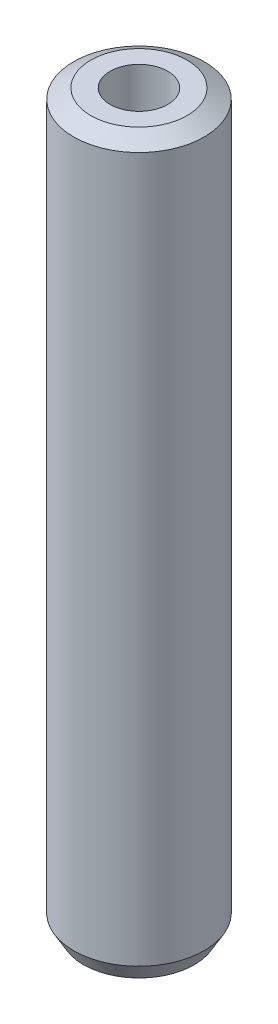
from build123d import *
from OCP.BRepFilletAPI import BRepFilletAPI_MakeChamfer

# Parameters (mm, degrees)
SKETCH1_R           = 20
BOSS_EXTRUDE1_DEPTH = 224.206713029
SKETCH2_R           = 8.832088122
CUT_EXTRUDE1_DEPTH  = 226.983738723
CHAMFER1_SIZE       = 3.035175179
CHAMFER1_SIZE2      = 5.25707762


with BuildPart() as part:
    # Sketch1 → Boss-Extrude1 (new body)
    with BuildSketch(Plane(origin=(0, 0, 0), x_dir=(1, 0, 0), z_dir=(0, 1, 0))):
        Circle(SKETCH1_R)
    extrude(amount=BOSS_EXTRUDE1_DEPTH)

    # Sketch2 → Cut-Extrude1 (cut, through all)
    with BuildSketch(Plane(origin=(0, 0, 0), x_dir=(1, 0, 0), z_dir=(0, 1, 0))):
        Circle(SKETCH2_R)
    extrude(amount=CUT_EXTRUDE1_DEPTH, mode=Mode.SUBTRACT)

    # Chamfer1: one chamfer whose edges measure the first distance from different faces: ONE call of the kernel's chamfer builder (chamfer() names one face for all edges)
    chamfer1_edges_1 = [part.edges().sort_by_distance(p)[0] for p in [
        (-20, 224.206713029, 0),
    ]]
    chamfer1_side_1 = [part.faces().sort_by_distance(p)[0] for p in [
        (-20, 112.103356514, 0),
    ]]
    chamfer1_edges_2 = [part.edges().sort_by_distance(p)[0] for p in [
        (-20, 0, 0),
    ]]
    chamfer1_side_2 = [part.faces().sort_by_distance(p)[0] for p in [
        (-19.434314575, 0, 0),
    ]]
    chamfer1 = BRepFilletAPI_MakeChamfer(part.part.solid().wrapped)
    for e in chamfer1_edges_1:
        chamfer1.Add(CHAMFER1_SIZE, CHAMFER1_SIZE2, e.wrapped, chamfer1_side_1[0].wrapped)  # the first distance lies on this face
    for e in chamfer1_edges_2:
        chamfer1.Add(CHAMFER1_SIZE, CHAMFER1_SIZE2, e.wrapped, chamfer1_side_2[0].wrapped)  # the first distance lies on this face
    add(Compound.cast(chamfer1.Shape()), mode=Mode.REPLACE)


solid = part.part
